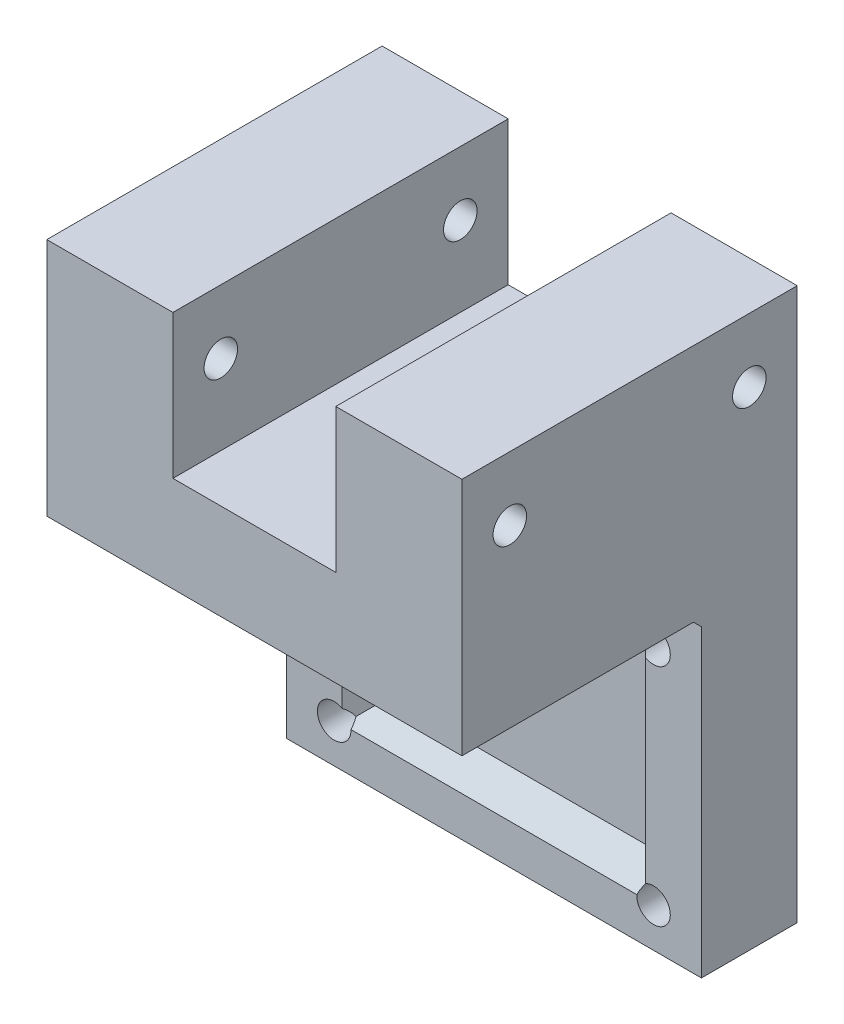
from build123d import *

# Parameters (mm, degrees)
SZKIC1_W                    = 52
SZKIC1_H                    = 38
SZKIC1_R                    = 2.1
DODANIE_WYCI_GNI_CIE1_DEPTH = 12
SZKIC2_W                    = 32
SZKIC2_H                    = 22
WYTNIJ_WYCI_GNI_CIE1_DEPTH  = 3
SFAZOWANIE1_SIZE            = 3
DODANIE_WYCI_GNI_CIE2_DEPTH = 12
DODANIE_WYCI_GNI_CIE3_DEPTH = 30
SFAZOWANIE2_SIZE            = 1
SZKIC6_R                    = 2.1
WYTNIJ_WYCI_GNI_CIE2_DEPTH  = 84.534483897


with BuildPart() as part:
    # Szkic1 → Dodanie-wyciągnięcie1 (new body)
    with BuildSketch(Plane.XY):
        Rectangle(SZKIC1_W, SZKIC1_H)
        with Locations((20, 14.1)):
            Circle(SZKIC1_R, mode=Mode.SUBTRACT)
        with Locations(Location((20, -14.1, 0), (0, 0, 180))):
            Circle(SZKIC1_R, mode=Mode.SUBTRACT)
        with Locations((-20, -14.1)):
            Circle(SZKIC1_R, mode=Mode.SUBTRACT)
        with Locations(Location((-20, 14.1, 0), (0, 0, 180))):
            Circle(SZKIC1_R, mode=Mode.SUBTRACT)
    extrude(amount=DODANIE_WYCI_GNI_CIE1_DEPTH)

    # Szkic2 → Wytnij-wyciągnięcie1 (cut)
    with BuildSketch(Plane.XY.offset(12)):
        Rectangle(SZKIC2_W, SZKIC2_H)
    extrude(amount=-WYTNIJ_WYCI_GNI_CIE1_DEPTH, mode=Mode.SUBTRACT)

    # Sfazowanie1
    # the kernel refuses this chamfer: 3 mm, written as the material it takes off along each edge
    with BuildSketch(Plane(origin=(16, -11, 12), x_dir=(0, -0.9996219169112969, 0.02749587661058621), z_dir=(-1, 0, 0))) as sfazowanie1_piece_1_section:
        Polygon((SFAZOWANIE1_SIZE * 0.999621916911, -SFAZOWANIE1_SIZE * 0.0274958766106), (-SFAZOWANIE1_SIZE * 0.0274958766106, -SFAZOWANIE1_SIZE * 0.999621916911), (0, 0), align=None)
    sfazowanie1_piece_1 = extrude(amount=32, mode=Mode.PRIVATE)
    sfazowanie1_piece_1 = split(sfazowanie1_piece_1, bisect_by=Plane(origin=(0, -11.991212463, 9), z_dir=(0, 0, 1)), keep=Keep.TOP, mode=Mode.PRIVATE)
    add(sfazowanie1_piece_1, mode=Mode.SUBTRACT)
    with BuildSketch(Plane(origin=(16, 11, 12), x_dir=(0.9996219169112968, 0, 0.02749587661058619), z_dir=(0, -1, 0))) as sfazowanie1_piece_2_section:
        Polygon((SFAZOWANIE1_SIZE * 0.999621916911, -SFAZOWANIE1_SIZE * 0.0274958766106), (-SFAZOWANIE1_SIZE * 0.0274958766106, -SFAZOWANIE1_SIZE * 0.999621916911), (0, 0), align=None)
    sfazowanie1_piece_2 = extrude(amount=22, mode=Mode.PRIVATE)
    sfazowanie1_piece_2 = split(sfazowanie1_piece_2, bisect_by=Plane(origin=(16.991212463, 0, 9), z_dir=(0, 0, 1)), keep=Keep.TOP, mode=Mode.PRIVATE)
    add(sfazowanie1_piece_2, mode=Mode.SUBTRACT)
    with BuildSketch(Plane(origin=(-16, -11, 12), x_dir=(-0.9996219169112968, 0, 0.02749587661058619), z_dir=(0, 1, 0))) as sfazowanie1_piece_3_section:
        Polygon((SFAZOWANIE1_SIZE * 0.999621916911, -SFAZOWANIE1_SIZE * 0.0274958766106), (-SFAZOWANIE1_SIZE * 0.0274958766106, -SFAZOWANIE1_SIZE * 0.999621916911), (0, 0), align=None)
    sfazowanie1_piece_3 = extrude(amount=22, mode=Mode.PRIVATE)
    sfazowanie1_piece_3 = split(sfazowanie1_piece_3, bisect_by=Plane(origin=(-16.991212463, 0, 9), z_dir=(0, 0, 1)), keep=Keep.TOP, mode=Mode.PRIVATE)
    add(sfazowanie1_piece_3, mode=Mode.SUBTRACT)
    with BuildSketch(Plane(origin=(-16, 11, 12), x_dir=(0, 0.9996219169112969, 0.02749587661058621), z_dir=(1, 0, 0))) as sfazowanie1_piece_4_section:
        Polygon((SFAZOWANIE1_SIZE * 0.999621916911, -SFAZOWANIE1_SIZE * 0.0274958766106), (-SFAZOWANIE1_SIZE * 0.0274958766106, -SFAZOWANIE1_SIZE * 0.999621916911), (0, 0), align=None)
    sfazowanie1_piece_4 = extrude(amount=32, mode=Mode.PRIVATE)
    sfazowanie1_piece_4 = split(sfazowanie1_piece_4, bisect_by=Plane(origin=(0, 11.991212463, 9), z_dir=(0, 0, 1)), keep=Keep.TOP, mode=Mode.PRIVATE)
    add(sfazowanie1_piece_4, mode=Mode.SUBTRACT)
    with BuildSketch(Plane(origin=(16, 11, 12), x_dir=(0.9996219169112968, 0, 0.02749587661058619), z_dir=(0, -1, 0))) as sfazowanie1_piece_5a_section:
        Polygon((SFAZOWANIE1_SIZE * 0.999621916911, -SFAZOWANIE1_SIZE * 0.0274958766106), (-SFAZOWANIE1_SIZE * 0.0274958766106, -SFAZOWANIE1_SIZE * 0.999621916911), (0, 0), align=None)
    sfazowanie1_piece_5a = extrude(amount=29.715048964, mode=Mode.PRIVATE)
    sfazowanie1_piece_5a = split(sfazowanie1_piece_5a, bisect_by=Plane(origin=(16.991212463, -11, 11.014096999), z_dir=(0, -1, 0)), keep=Keep.TOP, mode=Mode.PRIVATE)
    sfazowanie1_piece_5a = split(sfazowanie1_piece_5a, bisect_by=Plane(origin=(16.991212463, -14.857524482, 9), z_dir=(0, 0, 1)), keep=Keep.TOP, mode=Mode.PRIVATE)
    with BuildSketch(Plane(origin=(23.715048964, -11, 12), x_dir=(0, -0.9996219169112969, 0.02749587661058621), z_dir=(-1, 0, 0))) as sfazowanie1_piece_5b_section:
        Polygon((SFAZOWANIE1_SIZE * 0.999621916911, -SFAZOWANIE1_SIZE * 0.0274958766106), (-SFAZOWANIE1_SIZE * 0.0274958766106, -SFAZOWANIE1_SIZE * 0.999621916911), (0, 0), align=None)
    sfazowanie1_piece_5b = extrude(amount=39.715048964, mode=Mode.PRIVATE)
    sfazowanie1_piece_5b = split(sfazowanie1_piece_5b, bisect_by=Plane(origin=(16, -11.991212463, 11.014096999), z_dir=(1, 0, 0)), keep=Keep.TOP, mode=Mode.PRIVATE)
    sfazowanie1_piece_5b = split(sfazowanie1_piece_5b, bisect_by=Plane(origin=(19.857524482, -11.991212463, 9), z_dir=(0, 0, 1)), keep=Keep.TOP, mode=Mode.PRIVATE)
    sfazowanie1_piece_5 = sfazowanie1_piece_5a & sfazowanie1_piece_5b
    add(sfazowanie1_piece_5, mode=Mode.SUBTRACT)
    with BuildSketch(Plane(origin=(-16, -18.715048964, 12), x_dir=(-0.9996219169112968, 0, 0.02749587661058619), z_dir=(0, 1, 0))) as sfazowanie1_piece_6a_section:
        Polygon((SFAZOWANIE1_SIZE * 0.999621916911, -SFAZOWANIE1_SIZE * 0.0274958766106), (-SFAZOWANIE1_SIZE * 0.0274958766106, -SFAZOWANIE1_SIZE * 0.999621916911), (0, 0), align=None)
    sfazowanie1_piece_6a = extrude(amount=29.715048964, mode=Mode.PRIVATE)
    sfazowanie1_piece_6a = split(sfazowanie1_piece_6a, bisect_by=Plane(origin=(-16.991212463, -11, 11.014096999), z_dir=(0, -1, 0)), keep=Keep.TOP, mode=Mode.PRIVATE)
    sfazowanie1_piece_6a = split(sfazowanie1_piece_6a, bisect_by=Plane(origin=(-16.991212463, -14.857524482, 9), z_dir=(0, 0, 1)), keep=Keep.TOP, mode=Mode.PRIVATE)
    with BuildSketch(Plane(origin=(16, -11, 12), x_dir=(0, -0.9996219169112969, 0.02749587661058621), z_dir=(-1, 0, 0))) as sfazowanie1_piece_6b_section:
        Polygon((SFAZOWANIE1_SIZE * 0.999621916911, -SFAZOWANIE1_SIZE * 0.0274958766106), (-SFAZOWANIE1_SIZE * 0.0274958766106, -SFAZOWANIE1_SIZE * 0.999621916911), (0, 0), align=None)
    sfazowanie1_piece_6b = extrude(amount=39.715048964, mode=Mode.PRIVATE)
    sfazowanie1_piece_6b = split(sfazowanie1_piece_6b, bisect_by=Plane(origin=(-16, -11.991212463, 11.014096999), z_dir=(-1, 0, 0)), keep=Keep.TOP, mode=Mode.PRIVATE)
    sfazowanie1_piece_6b = split(sfazowanie1_piece_6b, bisect_by=Plane(origin=(-19.857524482, -11.991212463, 9), z_dir=(0, 0, 1)), keep=Keep.TOP, mode=Mode.PRIVATE)
    sfazowanie1_piece_6 = sfazowanie1_piece_6a & sfazowanie1_piece_6b
    add(sfazowanie1_piece_6, mode=Mode.SUBTRACT)
    with BuildSketch(Plane(origin=(16, 18.715048964, 12), x_dir=(0.9996219169112968, 0, 0.02749587661058619), z_dir=(0, -1, 0))) as sfazowanie1_piece_7a_section:
        Polygon((SFAZOWANIE1_SIZE * 0.999621916911, -SFAZOWANIE1_SIZE * 0.0274958766106), (-SFAZOWANIE1_SIZE * 0.0274958766106, -SFAZOWANIE1_SIZE * 0.999621916911), (0, 0), align=None)
    sfazowanie1_piece_7a = extrude(amount=29.715048964, mode=Mode.PRIVATE)
    sfazowanie1_piece_7a = split(sfazowanie1_piece_7a, bisect_by=Plane(origin=(16.991212463, 11, 11.014096999), z_dir=(0, 1, 0)), keep=Keep.TOP, mode=Mode.PRIVATE)
    sfazowanie1_piece_7a = split(sfazowanie1_piece_7a, bisect_by=Plane(origin=(16.991212463, 14.857524482, 9), z_dir=(0, 0, 1)), keep=Keep.TOP, mode=Mode.PRIVATE)
    with BuildSketch(Plane(origin=(-16, 11, 12), x_dir=(0, 0.9996219169112969, 0.02749587661058621), z_dir=(1, 0, 0))) as sfazowanie1_piece_7b_section:
        Polygon((SFAZOWANIE1_SIZE * 0.999621916911, -SFAZOWANIE1_SIZE * 0.0274958766106), (-SFAZOWANIE1_SIZE * 0.0274958766106, -SFAZOWANIE1_SIZE * 0.999621916911), (0, 0), align=None)
    sfazowanie1_piece_7b = extrude(amount=39.715048964, mode=Mode.PRIVATE)
    sfazowanie1_piece_7b = split(sfazowanie1_piece_7b, bisect_by=Plane(origin=(16, 11.991212463, 11.014096999), z_dir=(1, 0, 0)), keep=Keep.TOP, mode=Mode.PRIVATE)
    sfazowanie1_piece_7b = split(sfazowanie1_piece_7b, bisect_by=Plane(origin=(19.857524482, 11.991212463, 9), z_dir=(0, 0, 1)), keep=Keep.TOP, mode=Mode.PRIVATE)
    sfazowanie1_piece_7 = sfazowanie1_piece_7a & sfazowanie1_piece_7b
    add(sfazowanie1_piece_7, mode=Mode.SUBTRACT)
    with BuildSketch(Plane(origin=(-23.715048964, 11, 12), x_dir=(0, 0.9996219169112969, 0.02749587661058621), z_dir=(1, 0, 0))) as sfazowanie1_piece_8a_section:
        Polygon((SFAZOWANIE1_SIZE * 0.999621916911, -SFAZOWANIE1_SIZE * 0.0274958766106), (-SFAZOWANIE1_SIZE * 0.0274958766106, -SFAZOWANIE1_SIZE * 0.999621916911), (0, 0), align=None)
    sfazowanie1_piece_8a = extrude(amount=39.715048964, mode=Mode.PRIVATE)
    sfazowanie1_piece_8a = split(sfazowanie1_piece_8a, bisect_by=Plane(origin=(-16, 11.991212463, 11.014096999), z_dir=(-1, 0, 0)), keep=Keep.TOP, mode=Mode.PRIVATE)
    sfazowanie1_piece_8a = split(sfazowanie1_piece_8a, bisect_by=Plane(origin=(-19.857524482, 11.991212463, 9), z_dir=(0, 0, 1)), keep=Keep.TOP, mode=Mode.PRIVATE)
    with BuildSketch(Plane(origin=(-16, -11, 12), x_dir=(-0.9996219169112968, 0, 0.02749587661058619), z_dir=(0, 1, 0))) as sfazowanie1_piece_8b_section:
        Polygon((SFAZOWANIE1_SIZE * 0.999621916911, -SFAZOWANIE1_SIZE * 0.0274958766106), (-SFAZOWANIE1_SIZE * 0.0274958766106, -SFAZOWANIE1_SIZE * 0.999621916911), (0, 0), align=None)
    sfazowanie1_piece_8b = extrude(amount=29.715048964, mode=Mode.PRIVATE)
    sfazowanie1_piece_8b = split(sfazowanie1_piece_8b, bisect_by=Plane(origin=(-16.991212463, 11, 11.014096999), z_dir=(0, 1, 0)), keep=Keep.TOP, mode=Mode.PRIVATE)
    sfazowanie1_piece_8b = split(sfazowanie1_piece_8b, bisect_by=Plane(origin=(-16.991212463, 14.857524482, 9), z_dir=(0, 0, 1)), keep=Keep.TOP, mode=Mode.PRIVATE)
    sfazowanie1_piece_8 = sfazowanie1_piece_8a & sfazowanie1_piece_8b
    add(sfazowanie1_piece_8, mode=Mode.SUBTRACT)

    # Szkic3 → Dodanie-wyciągnięcie2 (add)
    with BuildSketch(Plane.XY.offset(12)):
        Polygon((-10.2, 32.1), (10.2, 32.1), (10.2, 50.1), (26, 50.1), (26, 19), (-26, 19), (-26, 50.1), (-10.2, 50.1), align=None)
    extrude(amount=-DODANIE_WYCI_GNI_CIE2_DEPTH)

    # Szkic4 → Dodanie-wyciągnięcie3 (add)
    with BuildSketch(Plane.XY.offset(12)):
        Polygon((-26, 20.1), (26, 20.1), (26, 50.1), (10.2, 50.1), (10.2, 32.1), (-10.2, 32.1), (-10.2, 50.1), (-26, 50.1), align=None)
    extrude(amount=DODANIE_WYCI_GNI_CIE3_DEPTH)

    # Sfazowanie2
    sfazowanie2_edges = [part.edges().sort_by_distance(p)[0] for p in [
        (0, 20.1, 12),
    ]]
    chamfer(sfazowanie2_edges, length=SFAZOWANIE2_SIZE)

    # Szkic6 → Wytnij-wyciągnięcie2 (cut, through all)
    with BuildSketch(Plane(origin=(26, 0, 0), x_dir=(0, 0, -1), z_dir=(1, 0, 0))):
        with Locations((-36, 42.1)):
            Circle(SZKIC6_R)
        with Locations((-6, 42.1)):
            Circle(SZKIC6_R)
    extrude(amount=-WYTNIJ_WYCI_GNI_CIE2_DEPTH, mode=Mode.SUBTRACT)


solid = part.part
